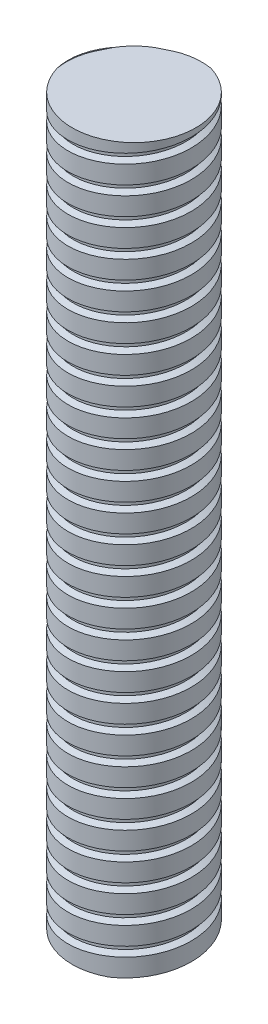
from build123d import *

# Parameters (mm, degrees)
ESBO_O1_R                 = 9
RESSALTO_EXTRUS_O1_DEPTH  = 52.75
VARREDURA_DE_CORTE1_PITCH = 4
ESBO_O4_R                 = 2.55
CORTE_EXTRUS_O1_DEPTH     = 20


with BuildPart() as part:
    # Esboço1 → Ressalto-extrusão1 (new, symmetric)
    with BuildSketch(Plane(origin=(0, 0, 0), x_dir=(1, 0, 0), z_dir=(0, 1, 0))):
        with Locations(Location((0, 0, 0), (0, 0, 270))):
            Circle(ESBO_O1_R)
    extrude(amount=RESSALTO_EXTRUS_O1_DEPTH, both=True)

    # Varredura de corte1: arcs per turn and ends read off the stored shape
    # Varredura de corte1: the profile of Esboço3 profile screwed along a right-hand helix through 28 turns, 12 arcs to a turn; built about Z, then put on its axis
    varredura_de_corte1_z = Axis((0, 0, 0), (0, 0, 1))
    varredura_de_corte1_corners = [(9.0003, 0, -3.314842919), (9.0003, 0, -4.685157005), (8.24, 0, -4.254999962), (8.24, 0, -3.744999962)]
    with BuildLine(mode=Mode.PRIVATE) as varredura_de_corte1_profile:
        Line(varredura_de_corte1_corners[0], varredura_de_corte1_corners[1])
        Line(varredura_de_corte1_corners[1], varredura_de_corte1_corners[2])
        Line(varredura_de_corte1_corners[2], varredura_de_corte1_corners[3])
        Line(varredura_de_corte1_corners[3], varredura_de_corte1_corners[0])
    varredura_de_corte1_cap = Face(varredura_de_corte1_profile.wire())
    varredura_de_corte1_turn_angles = [0, 15, 30, 45, 60, 75, 90, 105, 120, 135, 150, 165, 180, 195, 210, 225, 240, 255, 270, 285, 300, 315, 330, 345, 360]
    varredura_de_corte1_turn_weights = [1, 0.9659258262890683, 1, 0.9659258262890683, 1, 0.9659258262890683, 1, 0.9659258262890683, 1, 0.9659258262890683, 1, 0.9659258262890683, 1, 0.9659258262890683, 1, 0.9659258262890683, 1, 0.9659258262890683, 1, 0.9659258262890683, 1, 0.9659258262890683, 1, 0.9659258262890683, 1]
    varredura_de_corte1_turn_rails = [Edge.make_bspline([Vector(p[0], p[1], 0).rotate(varredura_de_corte1_z, varredura_de_corte1_turn_angles[k]) / varredura_de_corte1_turn_weights[k] + Vector(0, 0, p[2] + VARREDURA_DE_CORTE1_PITCH * varredura_de_corte1_turn_angles[k] / 360) for k in range(25)], [0, 0, 0, 1, 1, 2, 2, 3, 3, 4, 4, 5, 5, 6, 6, 7, 7, 8, 8, 9, 9, 10, 10, 11, 11, 12, 12, 12], 2, varredura_de_corte1_turn_weights) for p in varredura_de_corte1_corners]
    varredura_de_corte1_turn_sides = [Face.make_surface_from_curves(varredura_de_corte1_turn_rails[p[0]], varredura_de_corte1_turn_rails[p[1]]) for p in [(0, 1), (1, 2), (2, 3), (3, 0)]]
    varredura_de_corte1 = Plane(origin=(0, -52.75, 0), x_dir=(1, 0, 0), z_dir=(0, 1, 0)) * Solid(Shell([*[p.moved(Location((0, 0, VARREDURA_DE_CORTE1_PITCH * i))) for i in range(28) for p in varredura_de_corte1_turn_sides], varredura_de_corte1_cap, varredura_de_corte1_cap.rotate(varredura_de_corte1_z, 10080).moved(Location((0, 0, VARREDURA_DE_CORTE1_PITCH * 10080 / 360)))]))
    add(varredura_de_corte1, mode=Mode.SUBTRACT)

    # Esboço4 → Corte-extrusão1 (cut)
    with BuildSketch(Plane(origin=(0, -52.75, 0), x_dir=(-1, 0, 0), z_dir=(0, -1, 0))):
        with Locations(Location((0, 0, 0), (0, 0, 90))):
            Circle(ESBO_O4_R)
    extrude(amount=-CORTE_EXTRUS_O1_DEPTH, mode=Mode.SUBTRACT)


solid = part.part
